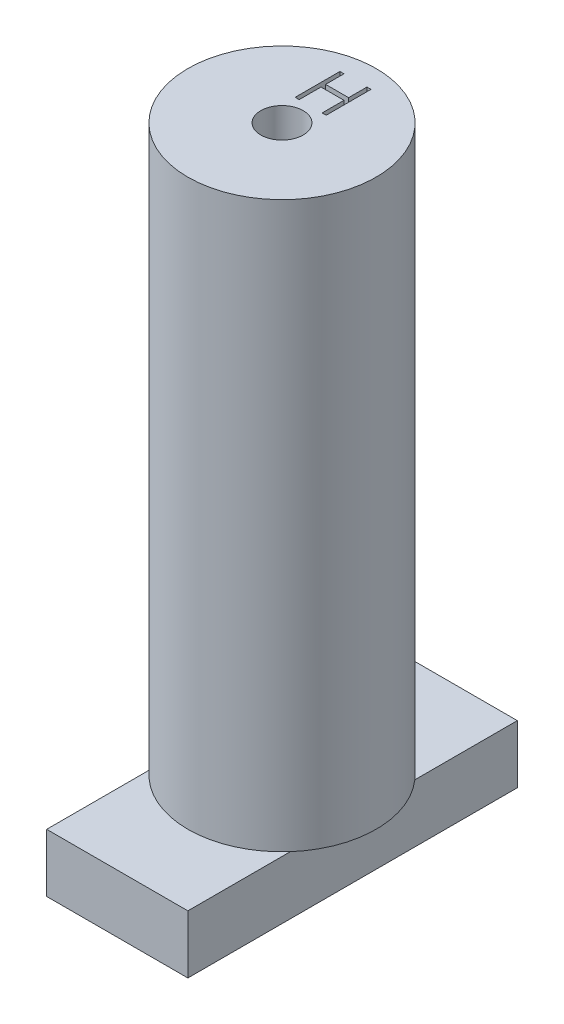
from build123d import *

# Parameters (mm, degrees)
SKETCH1_R           = 10
BOSS_EXTRUDE1_DEPTH = 4
SKETCH2_R           = 10
SKETCH2_R_2         = 8
SKETCH2_R_3         = 3.5
BOSS_EXTRUDE2_DEPTH = 52
SKETCH3_R           = 10
BOSS_EXTRUDE3_DEPTH = 4
CUT_EXTRUDE1_DEPTH  = 2
SKETCH5_R           = 2.25
CUT_EXTRUDE2_DEPTH  = 50
SKETCH6_W           = 15
SKETCH6_H           = 35
BOSS_EXTRUDE4_DEPTH = 6.18
SKETCH7_W           = 3.18
SKETCH7_H           = 13
CUT_EXTRUDE3_DEPTH  = 4.18


with BuildPart() as part:
    # Sketch1 → Boss-Extrude1 (new body)
    with BuildSketch(Plane(origin=(0, 0, 0), x_dir=(1, 0, 0), z_dir=(0, 1, 0))):
        Circle(SKETCH1_R)
    extrude(amount=BOSS_EXTRUDE1_DEPTH)

    # Sketch2 → Boss-Extrude2 (add)
    # profile 1 of 2: a face of its own
    with BuildSketch(Plane(origin=(0, 4, 0), x_dir=(1, 0, 0), z_dir=(0, 1, 0))):
        Circle(SKETCH2_R)
        Circle(SKETCH2_R_2, mode=Mode.SUBTRACT)
    # profile 2 of 2: a face of its own
    with BuildSketch(Plane(origin=(0, 4, 0), x_dir=(1, 0, 0), z_dir=(0, 1, 0))):
        Circle(SKETCH2_R_3)
    extrude(amount=BOSS_EXTRUDE2_DEPTH)

    # Sketch3 → Boss-Extrude3 (add)
    with BuildSketch(Plane(origin=(0, 56, 0), x_dir=(1, 0, 0), z_dir=(0, 1, 0))):
        Circle(SKETCH3_R)
    extrude(amount=BOSS_EXTRUDE3_DEPTH)

    # Sketch4 → Cut-Extrude1 (cut)
    with BuildSketch(Plane(origin=(0, 60, 0), x_dir=(1, 0, 0), z_dir=(0, 1, 0))):
        Polygon((-1.648557692, 7.80697224), (-1.221153846, 7.80697224), (-1.221153846, 5.853126086), (1.221153846, 5.853126086), (1.221153846, 7.80697224), (1.648557692, 7.80697224), (1.648557692, 3.04447224), (1.221153846, 3.04447224), (1.221153846, 5.364664548), (-1.221153846, 5.364664548), (-1.221153846, 3.04447224), (-1.648557692, 3.04447224), align=None)
    extrude(amount=-CUT_EXTRUDE1_DEPTH, mode=Mode.SUBTRACT)

    # Sketch5 → Cut-Extrude2 (cut)
    with BuildSketch(Plane(origin=(0, 60, 0), x_dir=(1, 0, 0), z_dir=(0, 1, 0))):
        Circle(SKETCH5_R)
    extrude(amount=-CUT_EXTRUDE2_DEPTH, mode=Mode.SUBTRACT)

    # Sketch6 → Boss-Extrude4 (add)
    with BuildSketch(Plane.XZ):
        Rectangle(SKETCH6_W, SKETCH6_H)
    extrude(amount=BOSS_EXTRUDE4_DEPTH)

    # Sketch7 → Cut-Extrude3 (cut)
    with BuildSketch(Plane.XZ.offset(6.18)):
        Rectangle(SKETCH7_W, SKETCH7_H)
    extrude(amount=-CUT_EXTRUDE3_DEPTH, mode=Mode.SUBTRACT)


solid = part.part
